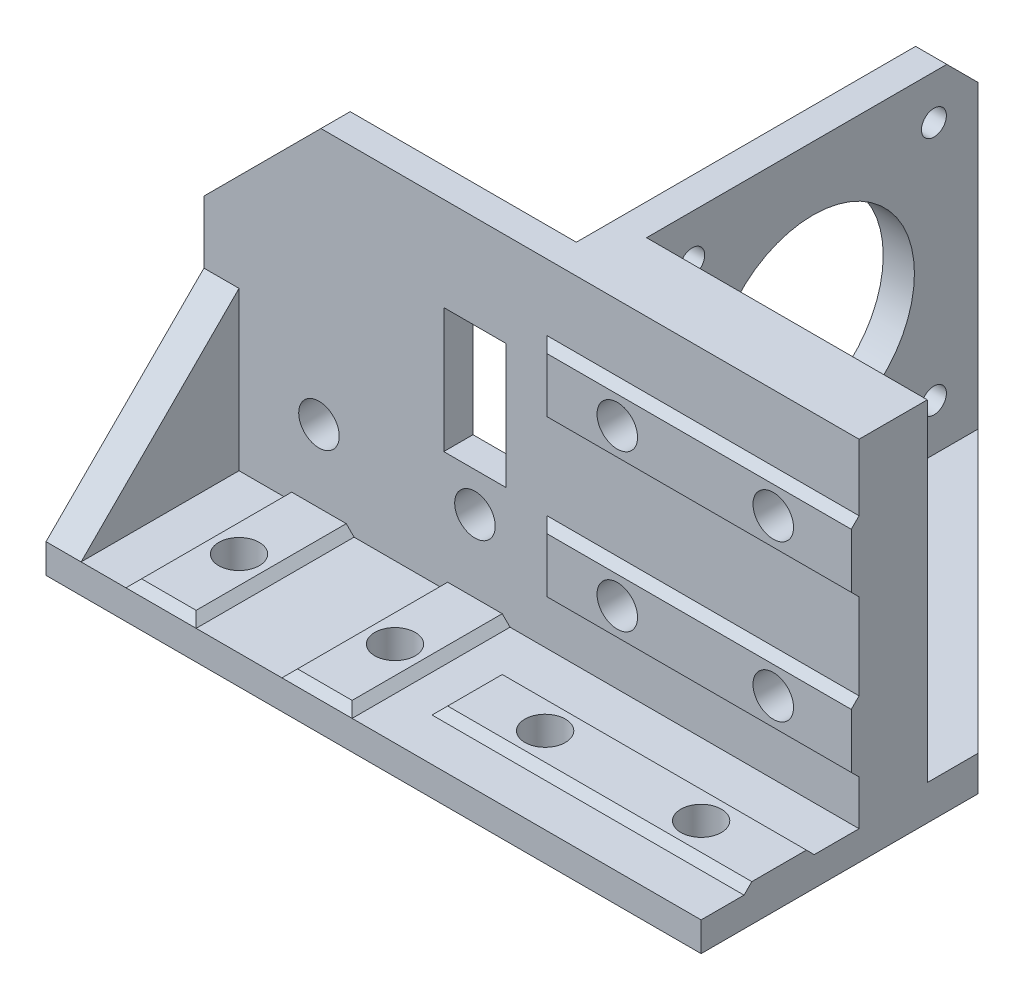
from build123d import *

# Parameters (mm, degrees)
BOSS_EXTRUDE1_DEPTH = 8.75
CUT_EXTRUDE1_DEPTH  = 5
BOSS_EXTRUDE2_DEPTH = 4
BOSS_EXTRUDE3_DEPTH = 4.5
SKETCH5_W           = 84
SKETCH5_H           = 20.25
BOSS_EXTRUDE4_DEPTH = 3.75
BOSS_EXTRUDE5_DEPTH = 4.5
SKETCH7_W           = 40
SKETCH7_H           = 9
SKETCH7_W_2         = 9
SKETCH7_H_2         = 20.25
BOSS_EXTRUDE6_DEPTH = 1
SKETCH8_W           = 40
SKETCH8_H           = 9
BOSS_EXTRUDE7_DEPTH = 1
CHAMFER1_SIZE       = 1
CUT_EXTRUDE2_REACH  = 105.186
SKETCH9_R           = 2.6
CUT_EXTRUDE3_REACH  = 111.522
SKETCH10_R          = 2.6
SKETCH10_W          = 8
SKETCH10_H          = 16
SKETCH12_R          = 4.5
CUT_EXTRUDE4_DEPTH  = 5
CUT_EXTRUDE5_REACH  = 81.494
SKETCH13_R          = 1.6
SKETCH13_R_2        = 13


with BuildPart() as part:
    # Sketch1 → Boss-Extrude1 (new body)
    with BuildSketch(Plane.XY):
        Polygon((0, 0), (84, 0), (84, 47), (15, 47), (0, 32), align=None)
    extrude(amount=BOSS_EXTRUDE1_DEPTH)

    # Sketch2 → Cut-Extrude1 (cut)
    with BuildSketch(Plane(origin=(0, 0, 0), x_dir=(-1, 0, 0), z_dir=(0, 0, -1))):
        Polygon((0, 0), (-44, 0), (-44, 47), (-15, 47), (0, 32), align=None)
    extrude(amount=-CUT_EXTRUDE1_DEPTH, mode=Mode.SUBTRACT)

    # Sketch3 → Boss-Extrude2 (add)
    with BuildSketch(Plane.ZY.offset(-44)):
        Polygon((0, 47), (-38.5, 47), (-42.5, 43), (-42.5, 0), (0, 0), align=None)
    extrude(amount=-BOSS_EXTRUDE2_DEPTH)

    # Sketch4 → Boss-Extrude3 (add)
    with BuildSketch(Plane.XZ):
        Polygon((48, 0), (84, 0), (84, -6.5), (48, -42.5), align=None)
    extrude(amount=-BOSS_EXTRUDE3_DEPTH)

    # Sketch5 → Boss-Extrude4 (add)
    with BuildSketch(Plane.XZ):
        with Locations((42, 18.875)):
            Rectangle(SKETCH5_W, SKETCH5_H)
    extrude(amount=-BOSS_EXTRUDE4_DEPTH)

    # Sketch6 → Boss-Extrude5 (add)
    with BuildSketch(Plane.ZY):
        Polygon((8.75, 3.75), (29, 3.75), (8.75, 24), align=None)
    extrude(amount=-BOSS_EXTRUDE5_DEPTH)

    # Sketch7 → Boss-Extrude6 (add)
    with BuildSketch(Plane(origin=(0, 3.75, 0), x_dir=(1, 0, 0), z_dir=(0, 1, 0))):
        with Locations((64, -19)):
            Rectangle(SKETCH7_W, SKETCH7_H)
        with Locations((14.75, -18.875)):
            Rectangle(SKETCH7_W_2, SKETCH7_H_2)
        with Locations((34.75, -18.875)):
            Rectangle(SKETCH7_W_2, SKETCH7_H_2)
    extrude(amount=BOSS_EXTRUDE6_DEPTH)

    # Sketch8 → Boss-Extrude7 (add)
    with BuildSketch(Plane.XY.offset(8.75)):
        with Locations((64, 14)):
            Rectangle(SKETCH8_W, SKETCH8_H)
        with Locations((64, 34)):
            Rectangle(SKETCH8_W, SKETCH8_H)
    extrude(amount=BOSS_EXTRUDE7_DEPTH)

    # Chamfer1
    chamfer1_edges = [part.edges().sort_by_distance(p)[0] for p in [
        (19.25, 4.75, 18.875),
        (14.75, 4.75, 29),
        (10.25, 4.75, 18.875),
        (30.25, 4.75, 18.875),
        (34.75, 4.75, 29),
        (39.25, 4.75, 18.875),
        (64, 4.75, 14.5),
        (64, 4.75, 23.5),
        (44, 4.75, 19),
        (64, 29.5, 9.75),
        (44, 34, 9.75),
        (64, 38.5, 9.75),
        (64, 9.5, 9.75),
        (64, 18.5, 9.75),
        (44, 14, 9.75),
    ]]
    chamfer(chamfer1_edges, length=CHAMFER1_SIZE - 0.0001)  # a hair under: the kernel refuses the full size

    # Sketch9 → Cut-Extrude2 (cut, up to next)
    with BuildSketch(Plane(origin=(0, 4.75, 0), x_dir=(1, 0, 0), z_dir=(0, 1, 0)), mode=Mode.PRIVATE) as cut_extrude2_sk1:
        with Locations(Location((14.75, -19, 0), (0, 0, 180))):
            Circle(SKETCH9_R)
    cut_extrude2_tool1 = extrude(cut_extrude2_sk1.sketch, amount=-CUT_EXTRUDE2_REACH, mode=Mode.PRIVATE) & part.part
    # Sketch9 → Cut-Extrude2 (cut, up to next)
    with BuildSketch(Plane(origin=(0, 4.75, 0), x_dir=(1, 0, 0), z_dir=(0, 1, 0)), mode=Mode.PRIVATE) as cut_extrude2_sk2:
        with Locations(Location((34.75, -19, 0), (0, 0, 180))):
            Circle(SKETCH9_R)
    cut_extrude2_tool2 = extrude(cut_extrude2_sk2.sketch, amount=-CUT_EXTRUDE2_REACH, mode=Mode.PRIVATE) & part.part
    # Sketch9 → Cut-Extrude2 (cut, up to next)
    with BuildSketch(Plane(origin=(0, 4.75, 0), x_dir=(1, 0, 0), z_dir=(0, 1, 0)), mode=Mode.PRIVATE) as cut_extrude2_sk3:
        with Locations(Location((54, -19, 0), (0, 0, 180))):
            Circle(SKETCH9_R)
    cut_extrude2_tool3 = extrude(cut_extrude2_sk3.sketch, amount=-CUT_EXTRUDE2_REACH, mode=Mode.PRIVATE) & part.part
    # Sketch9 → Cut-Extrude2 (cut, up to next)
    with BuildSketch(Plane(origin=(0, 4.75, 0), x_dir=(1, 0, 0), z_dir=(0, 1, 0)), mode=Mode.PRIVATE) as cut_extrude2_sk4:
        with Locations(Location((74, -19, 0), (0, 0, 180))):
            Circle(SKETCH9_R)
    cut_extrude2_tool4 = extrude(cut_extrude2_sk4.sketch, amount=-CUT_EXTRUDE2_REACH, mode=Mode.PRIVATE) & part.part
    add(cut_extrude2_tool1.solids().sort_by_distance((14.75, 4.75, 19))[0], mode=Mode.SUBTRACT)
    add(cut_extrude2_tool2.solids().sort_by_distance((34.75, 4.75, 19))[0], mode=Mode.SUBTRACT)
    add(cut_extrude2_tool3.solids().sort_by_distance((54, 4.75, 19))[0], mode=Mode.SUBTRACT)
    add(cut_extrude2_tool4.solids().sort_by_distance((74, 4.75, 19))[0], mode=Mode.SUBTRACT)

    # Sketch10 → Cut-Extrude3 (cut, up to next)
    with BuildSketch(Plane.XY.offset(9.75), mode=Mode.PRIVATE) as cut_extrude3_sk1:
        with Locations((54, 34)):
            Circle(SKETCH10_R)
    cut_extrude3_tool1 = extrude(cut_extrude3_sk1.sketch, amount=-CUT_EXTRUDE3_REACH, mode=Mode.PRIVATE) & part.part
    # Sketch10 → Cut-Extrude3 (cut, up to next)
    with BuildSketch(Plane.XY.offset(9.75), mode=Mode.PRIVATE) as cut_extrude3_sk2:
        with Locations((74, 34)):
            Circle(SKETCH10_R)
    cut_extrude3_tool2 = extrude(cut_extrude3_sk2.sketch, amount=-CUT_EXTRUDE3_REACH, mode=Mode.PRIVATE) & part.part
    # Sketch10 → Cut-Extrude3 (cut, up to next)
    with BuildSketch(Plane.XY.offset(9.75), mode=Mode.PRIVATE) as cut_extrude3_sk3:
        with Locations((54, 14)):
            Circle(SKETCH10_R)
    cut_extrude3_tool3 = extrude(cut_extrude3_sk3.sketch, amount=-CUT_EXTRUDE3_REACH, mode=Mode.PRIVATE) & part.part
    # Sketch10 → Cut-Extrude3 (cut, up to next)
    with BuildSketch(Plane.XY.offset(9.75), mode=Mode.PRIVATE) as cut_extrude3_sk4:
        with Locations((74, 14)):
            Circle(SKETCH10_R)
    cut_extrude3_tool4 = extrude(cut_extrude3_sk4.sketch, amount=-CUT_EXTRUDE3_REACH, mode=Mode.PRIVATE) & part.part
    # Sketch10 → Cut-Extrude3 (cut, up to next)
    with BuildSketch(Plane.XY.offset(9.75), mode=Mode.PRIVATE) as cut_extrude3_sk5:
        with Locations((34.75, 14)):
            Circle(SKETCH10_R)
    cut_extrude3_tool5 = extrude(cut_extrude3_sk5.sketch, amount=-CUT_EXTRUDE3_REACH, mode=Mode.PRIVATE) & part.part
    # Sketch10 → Cut-Extrude3 (cut, up to next)
    with BuildSketch(Plane.XY.offset(9.75), mode=Mode.PRIVATE) as cut_extrude3_sk6:
        with Locations((14.75, 14)):
            Circle(SKETCH10_R)
    cut_extrude3_tool6 = extrude(cut_extrude3_sk6.sketch, amount=-CUT_EXTRUDE3_REACH, mode=Mode.PRIVATE) & part.part
    # Sketch10 → Cut-Extrude3 (cut, up to next)
    with BuildSketch(Plane.XY.offset(9.75), mode=Mode.PRIVATE) as cut_extrude3_sk7:
        with Locations((34.75, 27)):
            Rectangle(SKETCH10_W, SKETCH10_H)
    cut_extrude3_tool7 = extrude(cut_extrude3_sk7.sketch, amount=-CUT_EXTRUDE3_REACH, mode=Mode.PRIVATE) & part.part
    add(cut_extrude3_tool1.solids().sort_by_distance((54, 34, 9.75))[0], mode=Mode.SUBTRACT)
    add(cut_extrude3_tool2.solids().sort_by_distance((74, 34, 9.75))[0], mode=Mode.SUBTRACT)
    add(cut_extrude3_tool3.solids().sort_by_distance((54, 14, 9.75))[0], mode=Mode.SUBTRACT)
    add(cut_extrude3_tool4.solids().sort_by_distance((74, 14, 9.75))[0], mode=Mode.SUBTRACT)
    add(cut_extrude3_tool5.solids().sort_by_distance((34.75, 14, 9.75))[0], mode=Mode.SUBTRACT)
    add(cut_extrude3_tool6.solids().sort_by_distance((14.75, 14, 9.75))[0], mode=Mode.SUBTRACT)
    add(cut_extrude3_tool7.solids().sort_by_distance((34.75, 27, 9.75))[0], mode=Mode.SUBTRACT)

    # Sketch12 → Cut-Extrude4 (cut)
    with BuildSketch(Plane(origin=(0, 0, 0), x_dir=(-1, 0, 0), z_dir=(0, 0, -1))):
        with Locations((-54, 34)):
            Circle(SKETCH12_R)
        with Locations((-74, 34)):
            Circle(SKETCH12_R)
        with Locations((-74, 14)):
            Circle(SKETCH12_R)
        with Locations((-54, 14)):
            Circle(SKETCH12_R)
    extrude(amount=-CUT_EXTRUDE4_DEPTH, mode=Mode.SUBTRACT)

    # Sketch13 → Cut-Extrude5 (cut, up to next)
    with BuildSketch(Plane(origin=(48, 0, 0), x_dir=(0, 0, -1), z_dir=(1, 0, 0)), mode=Mode.PRIVATE) as cut_extrude5_sk1:
        with Locations((5.85, 41.35)):
            Circle(SKETCH13_R)
    cut_extrude5_tool1 = extrude(cut_extrude5_sk1.sketch, amount=-CUT_EXTRUDE5_REACH, mode=Mode.PRIVATE) & part.part
    # Sketch13 → Cut-Extrude5 (cut, up to next)
    with BuildSketch(Plane(origin=(48, 0, 0), x_dir=(0, 0, -1), z_dir=(1, 0, 0)), mode=Mode.PRIVATE) as cut_extrude5_sk2:
        with Locations((36.85, 41.35)):
            Circle(SKETCH13_R)
    cut_extrude5_tool2 = extrude(cut_extrude5_sk2.sketch, amount=-CUT_EXTRUDE5_REACH, mode=Mode.PRIVATE) & part.part
    # Sketch13 → Cut-Extrude5 (cut, up to next)
    with BuildSketch(Plane(origin=(48, 0, 0), x_dir=(0, 0, -1), z_dir=(1, 0, 0)), mode=Mode.PRIVATE) as cut_extrude5_sk3:
        with Locations((36.85, 10.5)):
            Circle(SKETCH13_R)
    cut_extrude5_tool3 = extrude(cut_extrude5_sk3.sketch, amount=-CUT_EXTRUDE5_REACH, mode=Mode.PRIVATE) & part.part
    # Sketch13 → Cut-Extrude5 (cut, up to next)
    with BuildSketch(Plane(origin=(48, 0, 0), x_dir=(0, 0, -1), z_dir=(1, 0, 0)), mode=Mode.PRIVATE) as cut_extrude5_sk4:
        with Locations((5.85, 10.5)):
            Circle(SKETCH13_R)
    cut_extrude5_tool4 = extrude(cut_extrude5_sk4.sketch, amount=-CUT_EXTRUDE5_REACH, mode=Mode.PRIVATE) & part.part
    # Sketch13 → Cut-Extrude5 (cut, up to next)
    with BuildSketch(Plane(origin=(48, 0, 0), x_dir=(0, 0, -1), z_dir=(1, 0, 0)), mode=Mode.PRIVATE) as cut_extrude5_sk5:
        with Locations((21.35, 25.85)):
            Circle(SKETCH13_R_2)
    cut_extrude5_tool5 = extrude(cut_extrude5_sk5.sketch, amount=-CUT_EXTRUDE5_REACH, mode=Mode.PRIVATE) & part.part
    add(cut_extrude5_tool1.solids().sort_by_distance((48, 41.35, -5.85))[0], mode=Mode.SUBTRACT)
    add(cut_extrude5_tool2.solids().sort_by_distance((48, 41.35, -36.85))[0], mode=Mode.SUBTRACT)
    add(cut_extrude5_tool3.solids().sort_by_distance((48, 10.5, -36.85))[0], mode=Mode.SUBTRACT)
    add(cut_extrude5_tool4.solids().sort_by_distance((48, 10.5, -5.85))[0], mode=Mode.SUBTRACT)
    add(cut_extrude5_tool5.solids().sort_by_distance((48, 25.85, -21.35))[0], mode=Mode.SUBTRACT)


solid = part.part
